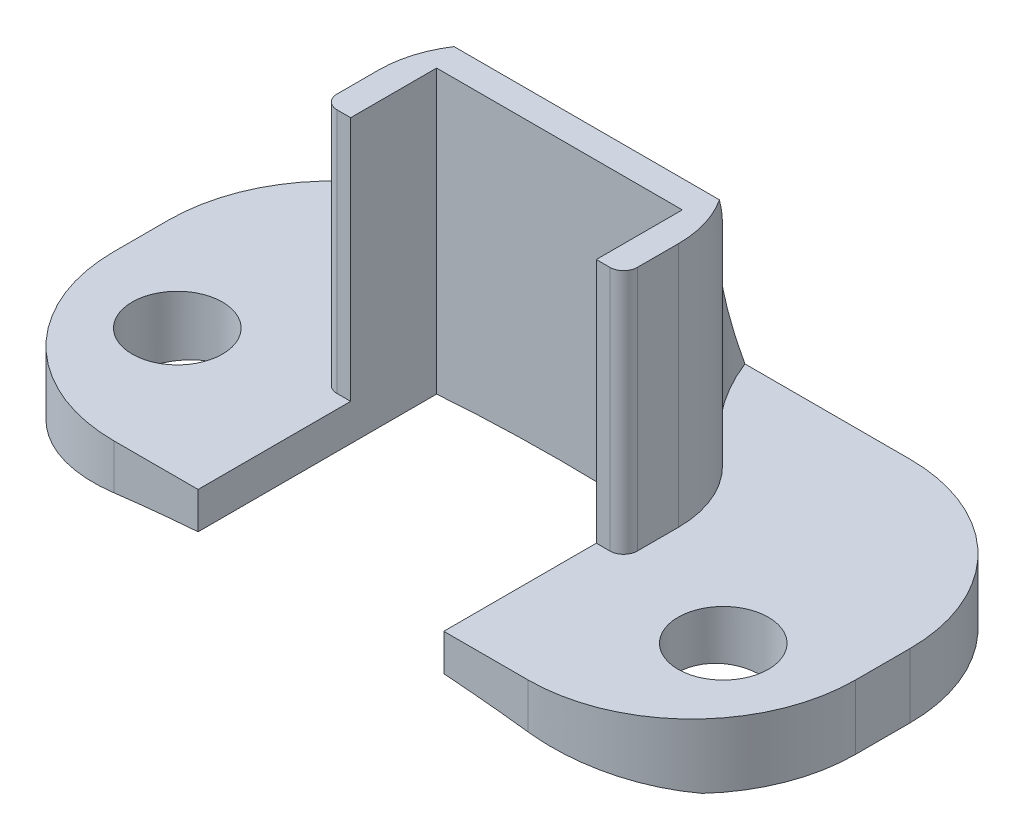
from build123d import *

# Parameters (mm, degrees)
SKETCH1_R               = 2.1
SKETCH1_W               = 1.815
SKETCH1_H               = 1
SKETCH1_H_2             = 3
BOSS_EXTRUDE1_DEPTH     = 3
BOSS_EXTRUDE2_START     = 3
SKETCH1_8_W             = 1.815
SKETCH1_8_H             = 1
BOSS_EXTRUDE2_DEPTH     = 11.43
CUT_EXTRUDE2_DEPTH      = 29.869778286
CUT_EXTRUDE2_DEPTH_BACK = 29.869778286
SKETCH2_R               = 78.359
CHAMFER1_SIZE           = 2.54
BOSS_EXTRUDE3_DEPTH     = 1.27
FILLET1_R               = 7.62
FILLET5_R               = 10
FILLET6_R               = 4.92
SKETCH7_W               = 11.43
SKETCH7_H               = 5.433942037
CUT_EXTRUDE4_DEPTH      = 29.869778458
FILLET7_R               = 0.635


with BuildPart() as part:
    # Sketch1 → Boss-Extrude1 (new body)
    # profile 1 of 6: a face of its own
    with BuildSketch(Plane(origin=(0, 0, 0), x_dir=(1, 0, 0), z_dir=(0, 1, 0))):
        Polygon((6.985, -10.998674064), (5.715, -10.998674064), (5.715, -15.888674064), (5.715, -18.096674099), (17.255421897, -18.096674099), (17.255421897, -0.316674099), (-17.255421897, -0.316674099), (-17.255421897, -18.096674099), (-5.715, -18.096674099), (-5.715, -15.888674064), (-5.715, -10.998674064), (-6.985, -10.998674064), (-6.985, -5.728674064), (6.985, -5.728674064), align=None)
        with Locations(Location((-12.7, -12.078674064, 0), (0, 0, 270))):
            Circle(SKETCH1_R, mode=Mode.SUBTRACT)
        with Locations(Location((12.7, -12.078674064, 0), (0, 0, 270))):
            Circle(SKETCH1_R, mode=Mode.SUBTRACT)
    # profile 2 of 6: a face of its own
    with BuildSketch(Plane(origin=(0, 0, 0), x_dir=(1, 0, 0), z_dir=(0, 1, 0))):
        Polygon((5.715, -9.998674064), (5.715, -10.998674064), (6.985, -10.998674064), (6.985, -5.728674064), (-6.985, -5.728674064), (-6.985, -10.998674064), (-5.715, -10.998674064), (-5.715, -9.998674064), (-5.715, -6.998674064), (-3.9, -6.998674064), (3.9, -6.998674064), (5.715, -6.998674064), align=None)
    # profile 3 of 6: a face of its own
    with BuildSketch(Plane(origin=(0, 0, 0), x_dir=(1, 0, 0), z_dir=(0, 1, 0))):
        with Locations((-4.8075, -10.498674064)):
            Rectangle(SKETCH1_W, SKETCH1_H)
    # profile 4 of 6: a face of its own
    with BuildSketch(Plane(origin=(0, 0, 0), x_dir=(1, 0, 0), z_dir=(0, 1, 0))):
        with Locations((-4.8075, -8.498674064)):
            Rectangle(SKETCH1_W, SKETCH1_H_2)
    # profile 5 of 6: a face of its own
    with BuildSketch(Plane(origin=(0, 0, 0), x_dir=(1, 0, 0), z_dir=(0, 1, 0))):
        with Locations((4.8075, -8.498674064)):
            Rectangle(SKETCH1_W, SKETCH1_H_2)
    # profile 6 of 6: a face of its own
    with BuildSketch(Plane(origin=(0, 0, 0), x_dir=(1, 0, 0), z_dir=(0, 1, 0))):
        with Locations((4.8075, -10.498674064)):
            Rectangle(SKETCH1_W, SKETCH1_H)
    extrude(amount=BOSS_EXTRUDE1_DEPTH)

    # Sketch1<8> → Boss-Extrude2 (add)
    with BuildSketch(Plane(origin=(0, 0, 0), x_dir=(1, 0, 0), z_dir=(0, 1, 0)).offset(BOSS_EXTRUDE2_START)):
        Polygon((5.715, -9.998674064), (5.715, -10.998674064), (6.985, -10.998674064), (6.985, -5.728674064), (-6.985, -5.728674064), (-6.985, -10.998674064), (-5.715, -10.998674064), (-5.715, -9.998674064), (-5.715, -6.998674064), (-3.9, -6.998674064), (3.9, -6.998674064), (5.715, -6.998674064), align=None)
        with Locations((4.8075, -10.498674064)):
            Rectangle(SKETCH1_8_W, SKETCH1_8_H)
        with Locations((-4.8075, -10.498674064)):
            Rectangle(SKETCH1_8_W, SKETCH1_8_H)
    extrude(amount=BOSS_EXTRUDE2_DEPTH)

    # Sketch2 → Cut-Extrude2 (cut, two sides: drawn at the far end of the back side and taken through both)
    with BuildSketch(Plane.XY.offset(-CUT_EXTRUDE2_DEPTH_BACK)):
        with Locations((0, -76.858999952)):
            Circle(SKETCH2_R)
    extrude(amount=CUT_EXTRUDE2_DEPTH + CUT_EXTRUDE2_DEPTH_BACK, mode=Mode.SUBTRACT)

    # Chamfer1
    # the kernel refuses this chamfer: 2.54 mm, written as the material it adds along each edge
    with BuildSketch(Plane(origin=(5.715, 3, 6.998674064), x_dir=(0.027495876610586268, 0.9996219169112968, 0), z_dir=(0, 0, 1))) as chamfer1_piece_1_section:
        Polygon((CHAMFER1_SIZE * 0.999621916911, CHAMFER1_SIZE * 0.0274958766106), (-CHAMFER1_SIZE * 0.0274958766106, CHAMFER1_SIZE * 0.999621916911), (0, 0), align=None)
    chamfer1_piece_1 = extrude(amount=3, mode=Mode.PRIVATE)
    chamfer1_piece_1 = split(chamfer1_piece_1, bisect_by=Plane(origin=(3.9, 3.90032925, 8.498674064), z_dir=(1, 0, 0)), keep=Keep.TOP, mode=Mode.PRIVATE)
    add(chamfer1_piece_1)
    with BuildSketch(Plane(origin=(-5.715, 3, 9.998674064), x_dir=(-0.027495876610586268, 0.9996219169112968, 0), z_dir=(0, 0, -1))) as chamfer1_piece_2_section:
        Polygon((CHAMFER1_SIZE * 0.999621916911, CHAMFER1_SIZE * 0.0274958766106), (-CHAMFER1_SIZE * 0.0274958766106, CHAMFER1_SIZE * 0.999621916911), (0, 0), align=None)
    chamfer1_piece_2 = extrude(amount=3, mode=Mode.PRIVATE)
    chamfer1_piece_2 = split(chamfer1_piece_2, bisect_by=Plane(origin=(-3.9, 3.90032925, 8.498674064), z_dir=(-1, 0, 0)), keep=Keep.TOP, mode=Mode.PRIVATE)
    add(chamfer1_piece_2)

    # Sketch6 → Boss-Extrude3 (add, symmetric)
    with BuildSketch(Plane(origin=(0, 0, 0), x_dir=(0, 0, -1), z_dir=(1, 0, 0))):
        Polygon((-5.728674064, 14.43), (-0.316674099, 3), (-5.728674064, 3), align=None)
    extrude(amount=BOSS_EXTRUDE3_DEPTH, both=True)

    # Fillet1
    fillet1_edges = [part.edges().sort_by_distance(p)[0] for p in [
        (-17.255421897, 1.5, 0.316674099),
        (17.255421897, 1.5, 0.316674099),
        (17.255421897, 1.5, 18.096674099),
        (-17.255421897, 1.5, 18.096674099),
    ]]
    fillet(fillet1_edges, radius=FILLET1_R)

    # Fillet5
    # the kernel refuses this fillet: 10 mm, written as the material it adds along each edge
    with BuildSketch(Plane(origin=(-1.27, 3, 5.728674064), x_dir=(-1, 0, 0), z_dir=(0, 1, 0))) as fillet5_piece_1_section:
        with BuildLine():
            CenterArc((10, -9.03541781), FILLET5_R, 115.372403981, 64.627596019)
            Line((0, -9.03541781), (0, 0))
            Line((0, 0), (5.715, 0))
        make_face()
    fillet5_piece_1 = extrude(amount=34.018544525, mode=Mode.PRIVATE)
    fillet5_piece_1 = split(fillet5_piece_1, bisect_by=Plane(origin=(-3.934188125, 8.906839934, 3.113508527), z_dir=(0, -0.42794357624145657, 0.9038054522703837)), keep=Keep.TOP, mode=Mode.PRIVATE)
    add(fillet5_piece_1)
    with BuildSketch(Plane(origin=(1.27, 3, 5.728674064), x_dir=(1, 0, 0), z_dir=(0, 1, 0))) as fillet5_piece_2_section:
        with BuildLine():
            CenterArc((10, 9.03541781), FILLET5_R, 180, 64.627596019)
            Line((0, 9.03541781), (0, 0))
            Line((0, 0), (5.715, 0))
        make_face()
    fillet5_piece_2 = extrude(amount=34.018544525, mode=Mode.PRIVATE)
    fillet5_piece_2 = split(fillet5_piece_2, bisect_by=Plane(origin=(3.934188125, 8.906839934, 3.113508527), z_dir=(0, -0.42794357624145657, 0.9038054522703837)), keep=Keep.TOP, mode=Mode.PRIVATE)
    add(fillet5_piece_2)

    # Fillet6
    fillet6_edges = [part.edges().sort_by_distance(p)[0] for p in [
        (6.985, 8.715, 5.728674064),
        (-6.985, 8.715, 5.728674064),
    ]]
    fillet(fillet6_edges, radius=FILLET6_R)

    # Sketch7 → Cut-Extrude4 (cut, through all)
    with BuildSketch(Plane(origin=(0, 14.43, 0), x_dir=(1, 0, 0), z_dir=(0, 1, 0))):
        with Locations((0, -9.715645083)):
            Rectangle(SKETCH7_W, SKETCH7_H)
    extrude(amount=-CUT_EXTRUDE4_DEPTH, mode=Mode.SUBTRACT)

    # Fillet7
    fillet7_edges = [part.edges().sort_by_distance(p)[0] for p in [
        (6.985, 8.715, 10.998674064),
        (-6.985, 8.715, 10.998674064),
    ]]
    fillet(fillet7_edges, radius=FILLET7_R)


solid = part.part
